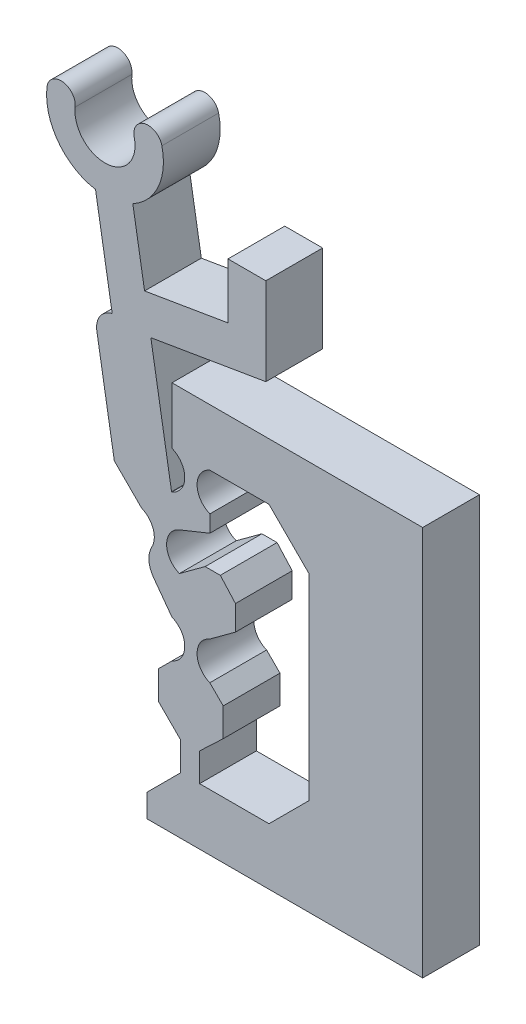
from build123d import *

# Parameters (mm, degrees)
BOSS_SWITCHMAIN_DEPTH = 3


with BuildPart() as part:
    # Sketch-SwitchBossUp → Boss-SwitchMain (new body)
    with BuildSketch(Plane.XY):
        with BuildLine():
            Line((6.540476927, 22.165014537), (6.540476927, 25.093856925))
            Line((6.540476927, 25.093856925), (8.540476927, 25.093856925))
            Line((8.540476927, 25.093856925), (8.540476927, 20.473554675))
            Line((8.540476927, 20.473554675), (2.463355023, 19.450530066))
            Line((2.463355023, 19.450530066), (3.558499615, 12.944990388))
            Line((3.558499615, 12.944990388), (3.581088316, 12.944953207))
            ThreePointArc((3.581088316, 12.944953207), (4.256080915, 13.944958203), (3.581073513, 14.944953207))
            Line((3.581073513, 14.944953207), (3.581073513, 17.94496801))
            Line((3.581073513, 17.94496801), (6.811292922, 17.94496801))
            Line((6.811292922, 17.94496801), (16.828083018, 17.94496801))
            Line((16.828083018, 17.94496801), (16.828083018, -2.673367153))
            Line((16.828083018, -2.673367153), (5.040476927, -2.673367153))
            Line((5.040476927, -2.673367153), (2.264617917, -2.673367153))
            Line((2.264617917, -2.673367153), (2.264617917, -1.449252451))
            Line((2.264617917, -1.449252451), (4.040476927, 0.326632847))
            Line((4.040476927, 0.326632847), (4.040476927, 1.826632847))
            Line((4.040476927, 1.826632847), (2.857692557, 3.009399709))
            Line((2.857692557, 3.009399709), (2.874043973, 4.509310584))
            Line((2.874043973, 4.509310584), (3.58114552, 5.216422599))
            ThreePointArc((3.58114552, 5.216422599), (4.256138119, 6.216427595), (3.581130717, 7.216422599))
            Line((3.581130717, 7.216422599), (2.603418204, 8.548280984))
            ThreePointArc((2.603418204, 8.548280984), (2.363042898, 9.20714873), (2.514052348, 9.892045174))
            ThreePointArc((2.514052348, 9.892045174), (2.58326881, 10.772563057), (1.97126394, 11.409393254))
            Line((1.97126394, 11.409393254), (0.5326123, 12.848023597))
            Line((0.5326123, 12.848023597), (-0.388805291, 18.321564484))
            ThreePointArc((-0.388805291, 18.321564484), (-0.224136417, 19.087558912), (0.421628056, 19.531238467))
            Line((0.421628056, 19.531238467), (-0.46073685, 24.772792819))
            ThreePointArc((-0.46073685, 24.772792819), (-2.424398677, 25.960025656), (-3.026553651, 28.17427473))
            ThreePointArc((-3.026553651, 28.17427473), (-2.19530667, 28.833083091), (-1.536498309, 28.001836109))
            ThreePointArc((-1.536498309, 28.001836109), (0.131578063, 26.234454713), (1.586154239, 28.18133014))
            ThreePointArc((1.586154239, 28.18133014), (2.145375848, 29.08259103), (3.046636738, 28.523369421))
            ThreePointArc((3.046636738, 28.523369421), (2.857030105, 26.554552243), (1.511513111, 25.104801997))
            Line((1.511513111, 25.104801997), (2.131345845, 21.422780026))
            Line((2.131345845, 21.422780026), (6.540476927, 22.165014537))
        make_face()
        with BuildLine():
            Line((5.581088316, 12.94496801), (5.581094877, 12.05857133))
            Line((5.581094877, 12.05857133), (3.97126394, 11.409408058))
            ThreePointArc((3.97126394, 11.409408058), (3.296271341, 10.409403061), (3.971278743, 9.409408058))
            Line((3.971278743, 9.409408058), (5.332971639, 10.409021979))
            Line((5.332971639, 10.409021979), (6.133921896, 10.409027907))
            Line((6.133921896, 10.409027907), (6.935397893, 9.518898634))
            Line((6.935397893, 9.518898634), (6.935397893, 8.210600129))
            Line((6.935397893, 8.210600129), (5.581130717, 7.216437402))
            ThreePointArc((5.581130717, 7.216437402), (4.906138119, 6.216432406), (5.58114552, 5.216437402))
            Line((5.58114552, 5.216437402), (6.288257535, 4.509335854))
            Line((6.288257535, 4.509335854), (6.288257535, 3.009335854))
            Line((6.288257535, 3.009335854), (5.040476927, 1.826632847))
            Line((5.040476927, 1.826632847), (5.040476927, 0.326632847))
            Line((5.040476927, 0.326632847), (8.706762674, 0.326632847))
            Line((8.706762674, 0.326632847), (10.828083018, 2.447953191))
            Line((10.828083018, 2.447953191), (10.828083018, 12.823647666))
            Line((10.828083018, 12.823647666), (8.706762674, 14.94496801))
            Line((8.706762674, 14.94496801), (6.811292922, 14.94496801))
            Line((6.811292922, 14.94496801), (5.581073513, 14.94496801))
            ThreePointArc((5.581073513, 14.94496801), (4.906080915, 13.944963014), (5.581088316, 12.94496801))
        make_face(mode=Mode.SUBTRACT)
    extrude(amount=BOSS_SWITCHMAIN_DEPTH)


solid = part.part
